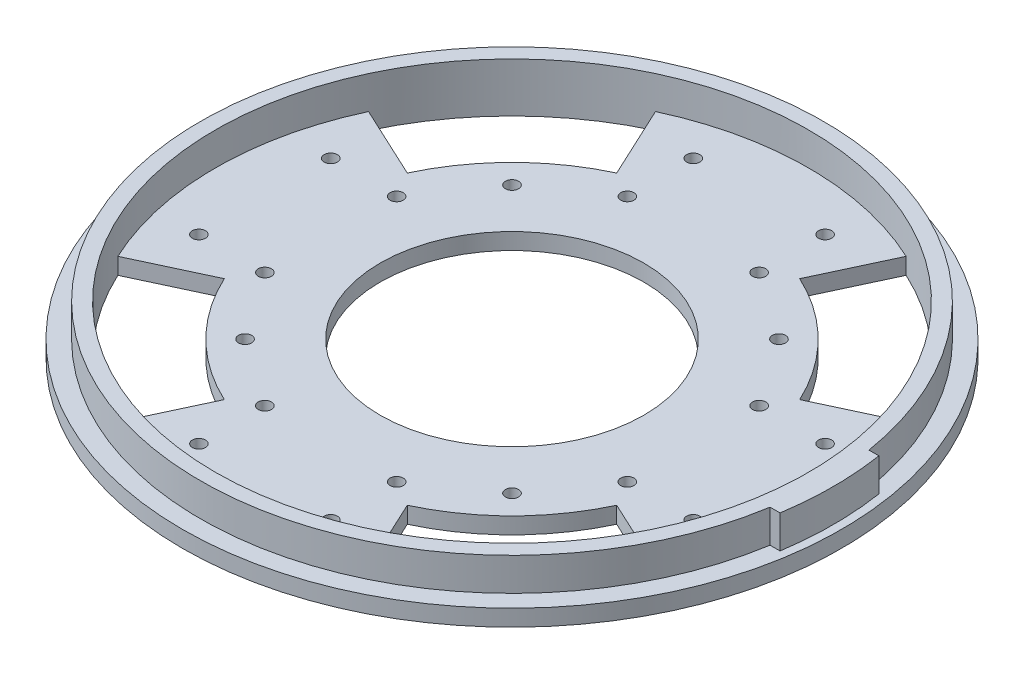
from build123d import *

# Parameters (mm, degrees)
SKETCH1_R             = 100
SKETCH1_R_2           = 40
BOSS_EXTRUDE1_DEPTH   = 5
F_4_0MM_DOWEL_HOLE1_D = 4
SKETCH6_R             = 95
SKETCH6_R_2           = 90
BOSS_EXTRUDE2_DEPTH   = 10
F_4_0MM_DOWEL_HOLE2_D = 4
CUT_EXTRUDE1_DEPTH    = 142.774468788
CIRPATTERN1_DEPTH     = 5
CUT_EXTRUDE2_START    = -10
SKETCH10_R            = 95
SKETCH10_R_2          = 94.5
CUT_EXTRUDE2_DEPTH    = 10
BOSS_EXTRUDE3_DEPTH   = 10


# Read off the part's stored shape, not the designer's step: CirPattern1
with BuildPart() as part:
    # Sketch1 → Boss-Extrude1 (new body)
    with BuildSketch(Plane(origin=(0, 0, 0), x_dir=(1, 0, 0), z_dir=(0, 1, 0))):
        with Locations(Location((0, 0, 0), (0, 0, 270))):
            Circle(SKETCH1_R)
        with Locations(Location((0, 0, 0), (0, 0, 270))):
            Circle(SKETCH1_R_2, mode=Mode.SUBTRACT)
    extrude(amount=BOSS_EXTRUDE1_DEPTH)

    # Ø4.0mm Dowel Hole1 (through all)
    with Locations(Plane(origin=(0, 5, 0), x_dir=(1, 0, 0), z_dir=(0, 1, 0))):
        with Locations((0, 0), (40.5, 40.5), (-40.5, -40.5), (-40.5, 40.5), (40.5, -40.5)):
            Hole(F_4_0MM_DOWEL_HOLE1_D / 2)

    # Sketch6 → Boss-Extrude2 (add)
    with BuildSketch(Plane(origin=(0, 5, 0), x_dir=(1, 0, 0), z_dir=(0, 1, 0))):
        with Locations(Location((0, 0, 0), (0, 0, 270))):
            Circle(SKETCH6_R)
        with Locations(Location((0, 0, 0), (0, 0, 270))):
            Circle(SKETCH6_R_2, mode=Mode.SUBTRACT)
    extrude(amount=BOSS_EXTRUDE2_DEPTH)

    # Ø4.0mm Dowel Hole2 (through all)
    with Locations(Plane(origin=(0, 5, 0), x_dir=(1, 0, 0), z_dir=(0, 1, 0))):
        with Locations((0, 0), (75, 20), (-75, -20), (-75, 20), (75, -20), (20, 75), (-20, -75), (-20, 75), (20, -75), (20, 55), (-20, -55), (-20, 55), (20, -55), (55, -20), (-55, 20), (-55, -20), (55, 20)):
            Hole(F_4_0MM_DOWEL_HOLE2_D / 2)

    # Sketch9 → Cut-Extrude1 (cut, through all)
    with BuildSketch(Plane(origin=(0, 5, 0), x_dir=(1, 0, 0), z_dir=(0, 1, 0))):
        with BuildLine():
            Line((81.567700833, -38.035643557), (59.537983888, -27.763017838))
            ThreePointArc((59.537983888, -27.763017838), (46.451892776, -46.451892776), (27.763017838, -59.537983888))
            Line((27.763017838, -59.537983888), (38.035643557, -81.567700833))
            ThreePointArc((38.035643557, -81.567700833), (63.639610307, -63.639610307), (81.567700833, -38.035643557))
        make_face()
    extrude(amount=-CUT_EXTRUDE1_DEPTH, mode=Mode.SUBTRACT)

    # CirPattern1 outline → CirPattern1 (cut)
    with BuildSketch(Plane(origin=(0, 0, 0), x_dir=(1, 0, 0), z_dir=(0, 1, 0))):
        with BuildLine():
            Line((59.537983888, 27.763017838), (81.567700833, 38.035643557))
            ThreePointArc((81.567700833, 38.035643557), (63.639610307, 63.639610307), (38.035643557, 81.567700833))
            Line((38.035643557, 81.567700833), (27.763017838, 59.537983888))
            ThreePointArc((27.763017838, 59.537983888), (46.451892776, 46.451892776), (59.537983888, 27.763017838))
        make_face()
        with BuildLine():
            ThreePointArc((-81.567700833, -38.035643557), (-63.639610307, -63.639610307), (-38.035643557, -81.567700833))
            Line((-38.035643557, -81.567700833), (-27.763017838, -59.537983888))
            ThreePointArc((-27.763017838, -59.537983888), (-46.451892776, -46.451892776), (-59.537983888, -27.763017838))
            Line((-59.537983888, -27.763017838), (-81.567700833, -38.035643557))
        make_face()
        with BuildLine():
            Line((-27.763017838, 59.537983888), (-38.035643557, 81.567700833))
            ThreePointArc((-38.035643557, 81.567700833), (-63.639610307, 63.639610307), (-81.567700833, 38.035643557))
            Line((-81.567700833, 38.035643557), (-59.537983888, 27.763017838))
            ThreePointArc((-59.537983888, 27.763017838), (-46.451892776, 46.451892776), (-27.763017838, 59.537983888))
        make_face()
    extrude(amount=CIRPATTERN1_DEPTH, mode=Mode.SUBTRACT)

    # Sketch10 → Cut-Extrude2 (cut)
    with BuildSketch(Plane(origin=(0, 15, 0), x_dir=(1, 0, 0), z_dir=(0, 1, 0)).offset(CUT_EXTRUDE2_START)):
        Circle(SKETCH10_R)
        with Locations(Location((0, 0, 0), (0, 0, 270))):
            Circle(SKETCH10_R_2, mode=Mode.SUBTRACT)
    extrude(amount=CUT_EXTRUDE2_DEPTH, mode=Mode.SUBTRACT)

    # Sketch11 → Boss-Extrude3 (add)
    with BuildSketch(Plane(origin=(0, 5, 0), x_dir=(1, 0, 0), z_dir=(0, 1, 0))):
        with BuildLine():
            Line((93.301929241, -15), (96.33924434, -15))
            Line((96.33924434, -15), (96.33924434, 15))
            Line((96.33924434, 15), (93.301929241, 15))
            ThreePointArc((93.301929241, 15), (94.200006139, 7.52388486), (94.5, 0))
            ThreePointArc((94.5, 0), (94.200006139, -7.52388486), (93.301929241, -15))
        make_face()
        with BuildLine():
            Line((96.33924434, 15), (96.33924434, -15))
            ThreePointArc((96.33924434, -15), (97.209377951, -7.522422378), (97.5, 0))
            ThreePointArc((97.5, 0), (97.209377951, 7.522422378), (96.33924434, 15))
        make_face()
    extrude(amount=BOSS_EXTRUDE3_DEPTH)


solid = part.part
